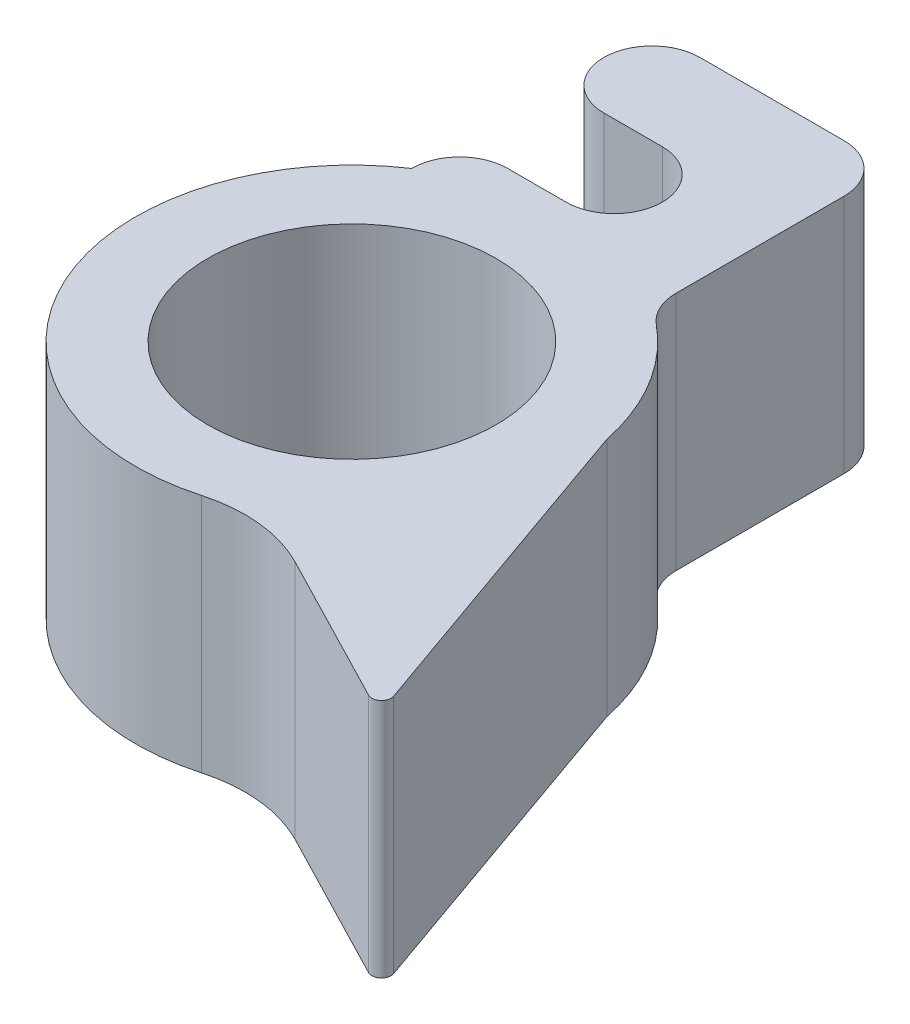
from build123d import *

# Parameters (mm, degrees)
SKETCH1_R           = 5.715
BOSS_EXTRUDE1_DEPTH = 6.35
SKETCH3_R           = 3.81
CUT_EXTRUDE1_DEPTH  = 6.35
BOSS_EXTRUDE3_DEPTH = 6.35
FILLET2_R           = 0.254
FILLET3_R           = 3.81
SKETCH4_W           = 6.35
SKETCH4_H           = 6.35
BOSS_EXTRUDE4_DEPTH = 6.35
SKETCH5_W           = 4.085425086
SKETCH5_H           = 2.54
CUT_EXTRUDE2_DEPTH  = 6.35
FILLET4_R           = 1.27


with BuildPart() as part:
    # Sketch1 → Boss-Extrude1 (new body)
    with BuildSketch(Plane(origin=(0, 0, 0), x_dir=(1, 0, 0), z_dir=(0, 1, 0))):
        with Locations(Location((0, 0, 0), (0, 0, 270))):
            Circle(SKETCH1_R)
    extrude(amount=BOSS_EXTRUDE1_DEPTH)

    # Sketch3 → Cut-Extrude1 (cut)
    with BuildSketch(Plane(origin=(0, 6.35, 0), x_dir=(1, 0, 0), z_dir=(0, 1, 0))):
        with Locations(Location((0, 0, 0), (0, 0, 270))):
            Circle(SKETCH3_R)
    extrude(amount=-CUT_EXTRUDE1_DEPTH, mode=Mode.SUBTRACT)

    # Sketch2 → Boss-Extrude3 (add)
    with BuildSketch(Plane(origin=(0, 6.35, 0), x_dir=(1, 0, 0), z_dir=(0, 1, 0))):
        Polygon((5.08, 2.618172072), (8.876921418, -8.162750326), (2.764587199, -5.001827928), align=None)
    extrude(amount=-BOSS_EXTRUDE3_DEPTH)

    # Fillet2
    fillet2_edges = [part.edges().sort_by_distance(p)[0] for p in [
        (8.876921418, 3.175, 8.162750326),
    ]]
    fillet(fillet2_edges, radius=FILLET2_R)

    # Fillet3
    fillet3_edges = [part.edges().sort_by_distance(p)[0] for p in [
        (2.764587199, 3.175, 5.001827928),
    ]]
    fillet(fillet3_edges, radius=FILLET3_R)

    # Sketch4 → Boss-Extrude4 (add)
    with BuildSketch(Plane(origin=(0, 6.35, 0), x_dir=(1, 0, 0), z_dir=(0, 1, 0))):
        with Locations((0, 7.926904881)):
            Rectangle(SKETCH4_W, SKETCH4_H)
    extrude(amount=-BOSS_EXTRUDE4_DEPTH)

    # Sketch5 → Cut-Extrude2 (cut)
    with BuildSketch(Plane(origin=(0, 6.35, 0), x_dir=(1, 0, 0), z_dir=(0, 1, 0))):
        with Locations((-1.132287457, 7.291904881)):
            Rectangle(SKETCH5_W, SKETCH5_H)
    extrude(amount=-CUT_EXTRUDE2_DEPTH, mode=Mode.SUBTRACT)

    # Fillet4
    fillet4_edges = [part.edges().sort_by_distance(p)[0] for p in [
        (3.175, 3.175, -4.751904881),
        (-3.175, 3.175, -6.021904881),
        (0.910425086, 3.175, -6.021904881),
        (0.910425086, 3.175, -8.561904881),
        (-3.175, 3.175, -8.561904881),
        (-3.175, 3.175, -11.101904881),
        (3.175, 3.175, -11.101904881),
    ]]
    fillet(fillet4_edges, radius=FILLET4_R - 0.0001)  # a hair under: the kernel refuses the full size


solid = part.part
